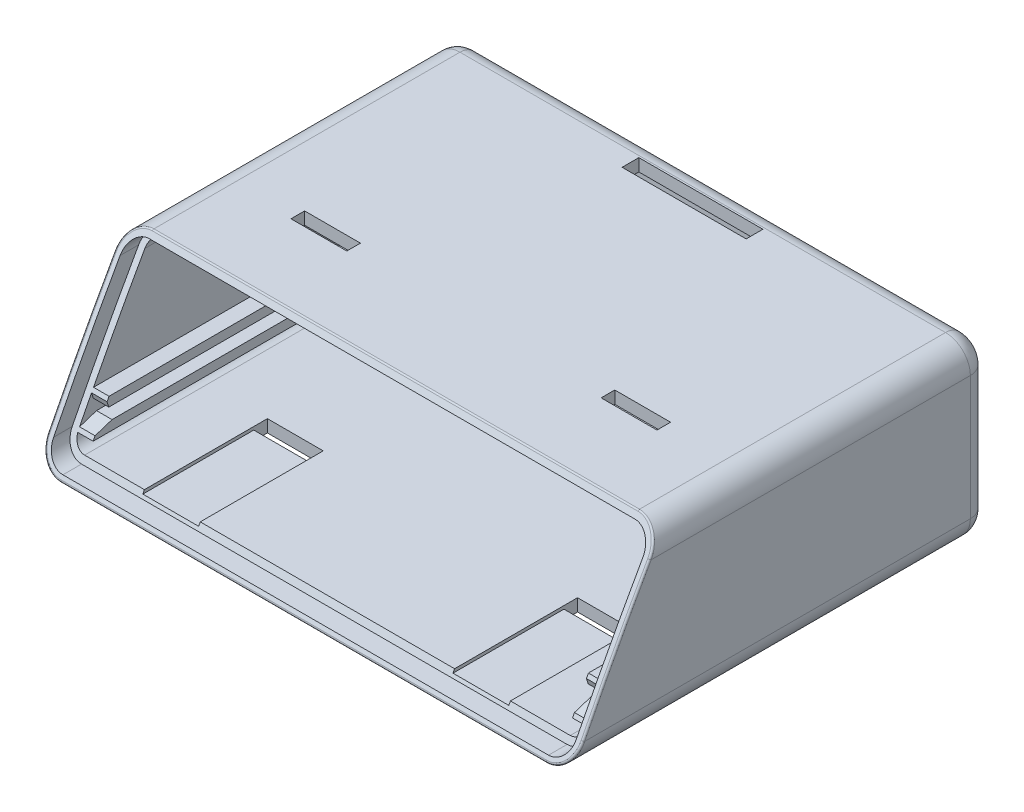
from build123d import *

# Parameters (mm, degrees)
SKETCH1_W                = 86.28
SKETCH1_H                = 67.5
BOSS_EXTRUDE1_DEPTH      = 28
FILLET1_R                = 4
SHELL1_T                 = -2
CUT_EXTRUDE1_DEPTH       = 97.784817508
SKETCH3_W                = 14.3
SKETCH3_H                = 16.7
SKETCH3_W_2              = 11.05
SKETCH3_H_2              = 14.049996967
CUT_EXTRUDE2_DEPTH       = 2
FILLET2_R                = 3
CUT_EXTRUDE3_REACH       = 165.279
CUT_EXTRUDE3_END_RADIUS  = 475
CUT_EXTRUDE3_START       = 80
FILLET3_R                = 0.3
BOSS_EXTRUDE2_REACH      = 85.135
BOSS_EXTRUDE2_END_RADIUS = 475
SKETCH5_W                = 2.5
SKETCH5_H                = 1.5
SKETCH6_W                = 9
SKETCH6_H                = 2.2
CUT_EXTRUDE4_DEPTH       = 2
SKETCH9_W                = 9
SKETCH9_H                = 2.2
CUT_EXTRUDE7_DEPTH       = 2
SKETCH7_W                = 20
SKETCH7_H                = 2.4
CUT_EXTRUDE5_DEPTH       = 2
SKETCH8_W                = 9
SKETCH8_H                = 0.5
CUT_EXTRUDE6_DEPTH       = 66.080519468
SKETCH10_W               = 9
SKETCH10_H               = 0.5
CUT_EXTRUDE8_DEPTH       = 69.920490525
SKETCH11_W               = 2.84
SKETCH11_H               = 2
SKETCH11_W_2             = 33.99
SKETCH11_W_3             = 20.1
BOSS_EXTRUDE3_DEPTH      = 0.5
CHAMFER1_SIZE2           = 2.284662113
CHAMFER1_SIZE            = 1
CHAMFER1_EDGE_2_SIZE2    = 0.742484525
CHAMFER1_EDGE_2_SIZE     = 1
CHAMFER1_EDGE_3_SIZE2    = 0.742484525
CHAMFER1_EDGE_3_SIZE     = 1
CHAMFER1_EDGE_4_SIZE2    = 2.284662113
CHAMFER1_EDGE_4_SIZE     = 1
SKETCH12_W               = 20
SKETCH12_H               = 2
CUT_EXTRUDE9_DEPTH       = 0.3


with BuildPart() as part:
    # Sketch1 → Boss-Extrude1 (new body)
    with BuildSketch(Plane(origin=(0, 0, 0), x_dir=(1, 0, 0), z_dir=(0, 1, 0))):
        Rectangle(SKETCH1_W, SKETCH1_H)
    extrude(amount=BOSS_EXTRUDE1_DEPTH)

    # Fillet1
    fillet1_edges = [part.edges().sort_by_distance(p)[0] for p in [
        (-43.14, 28, 0),
        (43.14, 28, 0),
        (-43.14, 0, 0),
        (43.14, 0, 0),
    ]]
    fillet(fillet1_edges, radius=FILLET1_R)

    # Shell1
    shell1_openings = [part.faces().sort_by_distance(p)[0] for p in [
        (0, 14, 33.75),
    ]]
    offset(amount=SHELL1_T, openings=shell1_openings, kind=Kind.INTERSECTION)

    # Sketch2 → Cut-Extrude1 (cut, through all)
    with BuildSketch(Plane.ZY.offset(43.14)):
        with BuildLine():
            Line((18.75, 28), (33.75, 28))
            Line((33.75, 28), (33.75, 0))
            ThreePointArc((33.75, 0), (26.484121584, 14.125422277), (18.75, 28))
        make_face()
    extrude(amount=-CUT_EXTRUDE1_DEPTH, mode=Mode.SUBTRACT)

    # Sketch3 → Cut-Extrude2 (cut)
    with BuildSketch(Plane(origin=(0, 0, -33.75), x_dir=(-1, 0, 0), z_dir=(0, 0, -1))):
        with Locations((0, 10.35)):
            Rectangle(SKETCH3_W, SKETCH3_H)
        with Locations((32.775, 10.175001517)):
            Rectangle(SKETCH3_W_2, SKETCH3_H_2)
    extrude(amount=-CUT_EXTRUDE2_DEPTH, mode=Mode.SUBTRACT)

    # Fillet2
    # the kernel refuses this fillet: 3 mm, written as the material it takes off along each edge
    with BuildSketch(Plane(origin=(39.14, 24, -33.75), x_dir=(1, 0, 0), z_dir=(0, -1, 0))) as fillet2_piece_1:
        with BuildLine():
            CenterArc((4 - FILLET2_R, FILLET2_R), FILLET2_R, 270, 90)
            Line((4, FILLET2_R), (4, 0))
            Line((4, 0), (4 - FILLET2_R, 0))
        make_face()
    revolve(axis=Axis((39.14, 24, -33.75), (0, 0, 1)), revolution_arc=90, mode=Mode.SUBTRACT)
    with BuildSketch(Plane(origin=(43.14, 4, -33.75), x_dir=(-1, 0, 0), z_dir=(0, 1, 0)), Plane(origin=(-43.14, 4, -33.75), x_dir=(0, 0, 1), z_dir=(0, 1, 0))) as fillet2_piece_2:
        with BuildLine():
            CenterArc((FILLET2_R, FILLET2_R), FILLET2_R, 180, 90)
            Line((0, FILLET2_R), (0, 0))
            Line((0, 0), (FILLET2_R, 0))
        make_face()
    extrude(amount=20, mode=Mode.SUBTRACT)
    with BuildSketch(Plane(origin=(39.14, 4, -33.75), x_dir=(1, 0, 0), z_dir=(0, 1, 0))) as fillet2_piece_3:
        with BuildLine():
            CenterArc((4 - FILLET2_R, -FILLET2_R), FILLET2_R, 0, 90)
            Line((4, -FILLET2_R), (4, 0))
            Line((4, 0), (4 - FILLET2_R, 0))
        make_face()
    revolve(axis=Axis((39.14, 4, -33.75), (0, 0, -1)), revolution_arc=90, mode=Mode.SUBTRACT)
    with BuildSketch(Plane(origin=(39.14, 0, -33.75), x_dir=(0, 1, 0), z_dir=(-1, 0, 0))) as fillet2_piece_4:
        with BuildLine():
            CenterArc((FILLET2_R, -FILLET2_R), FILLET2_R, 90, 90)
            Line((0, -FILLET2_R), (0, 0))
            Line((0, 0), (FILLET2_R, 0))
        make_face()
    extrude(amount=78.28, mode=Mode.SUBTRACT)
    with BuildSketch(Plane(origin=(-39.14, 4, -33.75), x_dir=(-1, 0, 0), z_dir=(0, 1, 0))) as fillet2_piece_5:
        with BuildLine():
            CenterArc((4 - FILLET2_R, FILLET2_R), FILLET2_R, 270, 90)
            Line((4 - FILLET2_R, 0), (4, 0))
            Line((4, 0), (4, FILLET2_R))
        make_face()
    revolve(axis=Axis((-39.14, 4, -33.75), (0, 0, 1)), revolution_arc=90, mode=Mode.SUBTRACT)
    with BuildSketch(Plane(origin=(-39.14, 24, -33.75), x_dir=(-1, 0, 0), z_dir=(0, -1, 0))) as fillet2_piece_6:
        with BuildLine():
            CenterArc((4 - FILLET2_R, -FILLET2_R), FILLET2_R, 0, 90)
            Line((4 - FILLET2_R, 0), (4, 0))
            Line((4, 0), (4, -FILLET2_R))
        make_face()
    revolve(axis=Axis((-39.14, 24, -33.75), (0, 0, -1)), revolution_arc=90, mode=Mode.SUBTRACT)
    with BuildSketch(Plane(origin=(39.14, 28, -33.75), x_dir=(0, -1, 0), z_dir=(-1, 0, 0))) as fillet2_piece_7:
        with BuildLine():
            CenterArc((FILLET2_R, FILLET2_R), FILLET2_R, 180, 90)
            Line((0, FILLET2_R), (0, 0))
            Line((0, 0), (FILLET2_R, 0))
        make_face()
    extrude(amount=78.28, mode=Mode.SUBTRACT)

    # Cut-Extrude3: up to this cylinder (the profile starts outside it)
    cut_extrude3_end = Plane(origin=(-23.145, -210.179748667, -395.218864179), z_dir=(-1, 0, 0)) * Cylinder(CUT_EXTRUDE3_END_RADIUS, 1281.558, mode=Mode.PRIVATE)
    # Sketch4 → Cut-Extrude3 (cut, up to the surface)
    with BuildSketch(Plane.XY.offset(-31.75).offset(CUT_EXTRUDE3_START), mode=Mode.PRIVATE) as cut_extrude3_sk1:
        with BuildLine():
            Line((-7.15, 1), (7.15, 1))
            Line((7.15, 1), (39.14, 1))
            ThreePointArc((39.14, 1), (41.261320344, 1.878679656), (42.14, 4))
            Line((42.14, 4), (42.14, 24))
            ThreePointArc((42.14, 24), (41.261320344, 26.121320344), (39.14, 27))
            Line((39.14, 27), (-39.14, 27))
            ThreePointArc((-39.14, 27), (-41.261320344, 26.121320344), (-42.14, 24))
            Line((-42.14, 24), (-42.14, 4))
            ThreePointArc((-42.14, 4), (-41.261320344, 1.878679656), (-39.14, 1))
            Line((-39.14, 1), (-7.15, 1))
        make_face()
        with BuildLine():
            Line((-7.15, 2), (7.15, 2))
            Line((7.15, 2), (39.14, 2))
            ThreePointArc((39.14, 2), (40.554213562, 2.585786438), (41.14, 4))
            Line((41.14, 4), (41.14, 24))
            ThreePointArc((41.14, 24), (40.554213562, 25.414213562), (39.14, 26))
            Line((39.14, 26), (-39.14, 26))
            ThreePointArc((-39.14, 26), (-40.554213562, 25.414213562), (-41.14, 24))
            Line((-41.14, 24), (-41.14, 4))
            ThreePointArc((-41.14, 4), (-40.554213562, 2.585786438), (-39.14, 2))
            Line((-39.14, 2), (-7.15, 2))
        make_face(mode=Mode.SUBTRACT)
    cut_extrude3_tool1 = extrude(cut_extrude3_sk1.sketch, amount=-CUT_EXTRUDE3_REACH, mode=Mode.PRIVATE) - cut_extrude3_end
    add(cut_extrude3_tool1.solids().sort_by_distance((-23.145, 1.881993, 48.25))[0], mode=Mode.SUBTRACT)

    # Fillet3
    fillet3_edges = [part.edges().sort_by_distance(p)[0] for p in [
        (0, 0, 33.75),
        (-43.14, 14.0639546, 26.517044891),
        (42.064985447, 26.728453829, 19.484309952),
        (42.046759663, 1.252137501, 33.12988391),
        (-42.046759662, 1.252137501, 33.12988391),
        (-42.064985447, 26.728453829, 19.484309952),
        (43.14, 14.0639546, 26.517044891),
        (0, 28, 18.75),
    ]]
    fillet(fillet3_edges, radius=FILLET3_R)

    # Boss-Extrude2: up to this cylinder (the profile starts inside it)
    boss_extrude2_end = Plane(origin=(0, -210.179748667, -395.218864179), z_dir=(-1, 0, 0)) * Cylinder(BOSS_EXTRUDE2_END_RADIUS, 1201.05, mode=Mode.PRIVATE)
    # Sketch5 → Boss-Extrude2 (add, up to the surface)
    with BuildSketch(Plane.XY.offset(-31.75), mode=Mode.PRIVATE) as boss_extrude2_sk1:
        with Locations((39.89, 4.5)):
            Rectangle(SKETCH5_W, SKETCH5_H)
    boss_extrude2_tool1 = extrude(boss_extrude2_sk1.sketch, amount=BOSS_EXTRUDE2_REACH, mode=Mode.PRIVATE) & boss_extrude2_end
    add(boss_extrude2_tool1.solids().sort_by_distance((39.89, 4.5, -31.75))[0])
    # Sketch5 → Boss-Extrude2 (add, up to the surface)
    with BuildSketch(Plane.XY.offset(-31.75), mode=Mode.PRIVATE) as boss_extrude2_sk2:
        with Locations((39.89, 8)):
            Rectangle(SKETCH5_W, SKETCH5_H)
    boss_extrude2_tool2 = extrude(boss_extrude2_sk2.sketch, amount=BOSS_EXTRUDE2_REACH, mode=Mode.PRIVATE) & boss_extrude2_end
    add(boss_extrude2_tool2.solids().sort_by_distance((39.89, 8, -31.75))[0])
    # Sketch5 → Boss-Extrude2 (add, up to the surface)
    with BuildSketch(Plane.XY.offset(-31.75), mode=Mode.PRIVATE) as boss_extrude2_sk3:
        with Locations((-39.89, 8)):
            Rectangle(SKETCH5_W, SKETCH5_H)
    boss_extrude2_tool3 = extrude(boss_extrude2_sk3.sketch, amount=BOSS_EXTRUDE2_REACH, mode=Mode.PRIVATE) & boss_extrude2_end
    add(boss_extrude2_tool3.solids().sort_by_distance((-39.89, 8, -31.75))[0])
    # Sketch5 → Boss-Extrude2 (add, up to the surface)
    with BuildSketch(Plane.XY.offset(-31.75), mode=Mode.PRIVATE) as boss_extrude2_sk4:
        with Locations((-39.89, 4.5)):
            Rectangle(SKETCH5_W, SKETCH5_H)
    boss_extrude2_tool4 = extrude(boss_extrude2_sk4.sketch, amount=BOSS_EXTRUDE2_REACH, mode=Mode.PRIVATE) & boss_extrude2_end
    add(boss_extrude2_tool4.solids().sort_by_distance((-39.89, 4.5, -31.75))[0])

    # Sketch6 → Cut-Extrude4 (cut)
    with BuildSketch(Plane(origin=(0, 28, 0), x_dir=(1, 0, 0), z_dir=(0, 1, 0))):
        with Locations((25, -5.03)):
            Rectangle(SKETCH6_W, SKETCH6_H)
        with Locations((-25, -5.03)):
            Rectangle(SKETCH6_W, SKETCH6_H)
    extrude(amount=-CUT_EXTRUDE4_DEPTH, mode=Mode.SUBTRACT)

    # Sketch9 → Cut-Extrude7 (cut)
    with BuildSketch(Plane.XZ):
        with Locations((-25, 11.03)):
            Rectangle(SKETCH9_W, SKETCH9_H)
        with Locations((25, 11.03)):
            Rectangle(SKETCH9_W, SKETCH9_H)
    extrude(amount=-CUT_EXTRUDE7_DEPTH, mode=Mode.SUBTRACT)

    # Sketch7 → Cut-Extrude5 (cut)
    with BuildSketch(Plane(origin=(0, 28, 0), x_dir=(1, 0, 0), z_dir=(0, 1, 0))):
        with Locations((0, 28.95)):
            Rectangle(SKETCH7_W, SKETCH7_H)
    extrude(amount=-CUT_EXTRUDE5_DEPTH, mode=Mode.SUBTRACT)

    # Sketch8 → Cut-Extrude6 (cut, through all)
    with BuildSketch(Plane(origin=(0, 0, 6.13), x_dir=(-1, 0, 0), z_dir=(0, 0, -1))):
        with Locations((-25, 26.25)):
            Rectangle(SKETCH8_W, SKETCH8_H)
        with Locations((25, 26.25)):
            Rectangle(SKETCH8_W, SKETCH8_H)
    extrude(amount=-CUT_EXTRUDE6_DEPTH, mode=Mode.SUBTRACT)

    # Sketch10 → Cut-Extrude8 (cut, through all)
    with BuildSketch(Plane(origin=(0, 0, 12.13), x_dir=(-1, 0, 0), z_dir=(0, 0, -1))):
        with Locations((25, 1.75)):
            Rectangle(SKETCH10_W, SKETCH10_H)
        with Locations((-25, 1.75)):
            Rectangle(SKETCH10_W, SKETCH10_H)
    extrude(amount=-CUT_EXTRUDE8_DEPTH, mode=Mode.SUBTRACT)

    # Sketch11 → Boss-Extrude3 (add)
    with BuildSketch(Plane.XY.offset(-31.75)):
        with Locations((-39.72, 6.25)):
            Rectangle(SKETCH11_W, SKETCH11_H)
        with Locations((24.145, 6.25)):
            Rectangle(SKETCH11_W_2, SKETCH11_H)
        with Locations((-17.2, 6.25)):
            Rectangle(SKETCH11_W_3, SKETCH11_H)
    extrude(amount=BOSS_EXTRUDE3_DEPTH)

    # Chamfer1
    chamfer1_edges = [part.edges().sort_by_distance(p)[0] for p in [
        (39.89, 5.25, 28.11908993),
    ]]
    chamfer(chamfer1_edges, length=CHAMFER1_SIZE, length2=CHAMFER1_SIZE2)

    # Chamfer1 edge 2
    chamfer1_edge_2_edges = [part.edges().sort_by_distance(p)[0] for p in [
        (39.89, 7.25, 27.095360533),
    ]]
    chamfer(chamfer1_edge_2_edges, length=CHAMFER1_EDGE_2_SIZE, length2=CHAMFER1_EDGE_2_SIZE2)

    # Chamfer1 edge 3
    chamfer1_edge_3_edges = [part.edges().sort_by_distance(p)[0] for p in [
        (-39.89, 7.25, 27.095360533),
    ]]
    chamfer(chamfer1_edge_3_edges, length=CHAMFER1_EDGE_3_SIZE, length2=CHAMFER1_EDGE_3_SIZE2)

    # Chamfer1 edge 4
    chamfer1_edge_4_edges = [part.edges().sort_by_distance(p)[0] for p in [
        (-39.89, 5.25, 28.11908993),
    ]]
    chamfer(chamfer1_edge_4_edges, length=CHAMFER1_EDGE_4_SIZE, length2=CHAMFER1_EDGE_4_SIZE2)

    # Sketch12 → Cut-Extrude9 (cut)
    with BuildSketch(Plane.XY.offset(-30.15)):
        with Locations((0, 27)):
            Rectangle(SKETCH12_W, SKETCH12_H)
    extrude(amount=-CUT_EXTRUDE9_DEPTH, mode=Mode.SUBTRACT)


solid = part.part
